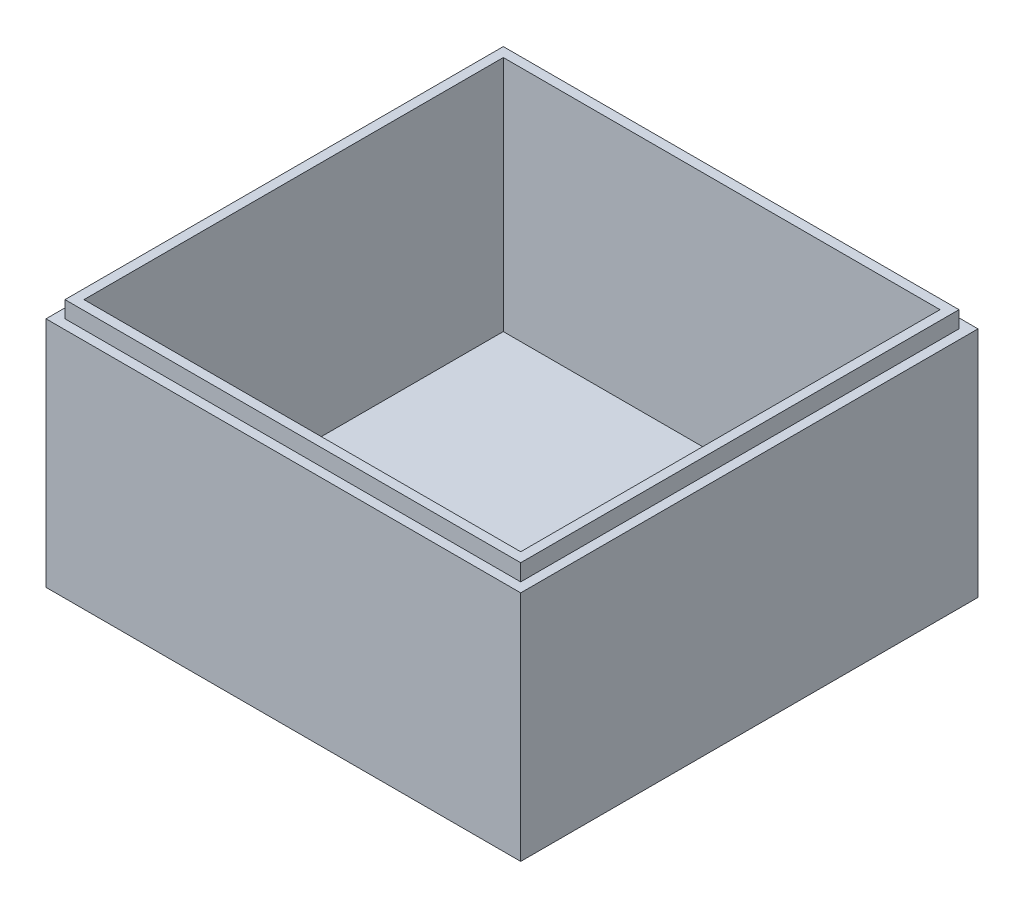
from build123d import *

# Parameters (mm, degrees)
BATTERYANDOUTERWALLS_W   = 60
BATTERYANDOUTERWALLS_H   = 57.8
BATTERYANDOUTERWALLS_W_2 = 55.2
BATTERYANDOUTERWALLS_H_2 = 53
WALLS_DEPTH              = 30
SKETCH2_W                = 60
SKETCH2_H                = 57.8
BOTTOM_DEPTH             = 1.5
SINKRIM_W                = 60
SINKRIM_H                = 57.8
SINKRIM_W_2              = 57.6
SINKRIM_H_2              = 55.4
TOP_CUT_DEPTH            = 2.1


with BuildPart() as part:
    # BatteryAndOuterWalls → Walls (new body)
    with BuildSketch(Plane(origin=(0, 0, 0), x_dir=(1, 0, 0), z_dir=(0, 1, 0))):
        Rectangle(BATTERYANDOUTERWALLS_W, BATTERYANDOUTERWALLS_H)
        Rectangle(BATTERYANDOUTERWALLS_W_2, BATTERYANDOUTERWALLS_H_2, mode=Mode.SUBTRACT)
    extrude(amount=WALLS_DEPTH)

    # Sketch2 → Bottom (add)
    with BuildSketch(Plane.XZ):
        Rectangle(SKETCH2_W, SKETCH2_H)
    extrude(amount=BOTTOM_DEPTH)

    # SinkRim → Top-Cut (cut)
    with BuildSketch(Plane(origin=(0, 30, 0), x_dir=(1, 0, 0), z_dir=(0, 1, 0))):
        Rectangle(SINKRIM_W, SINKRIM_H)
        Rectangle(SINKRIM_W_2, SINKRIM_H_2, mode=Mode.SUBTRACT)
    extrude(amount=-TOP_CUT_DEPTH, mode=Mode.SUBTRACT)


solid = part.part
